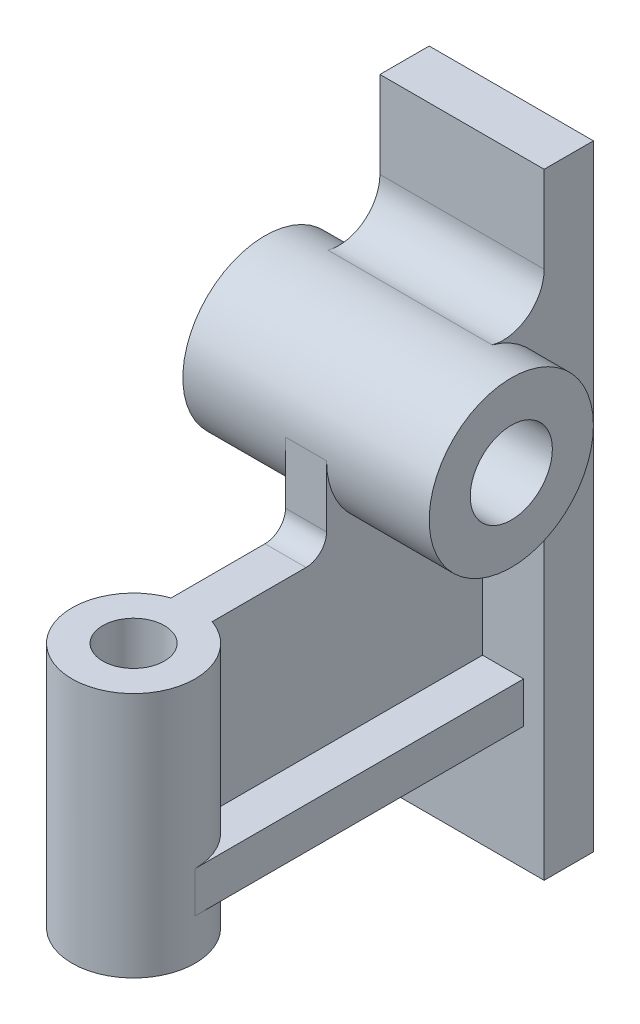
from build123d import *

# Parameters (mm, degrees)
SKETCH1_W                = 150
SKETCH1_H                = 12
BOSS_EXTRUDE1_DEPTH      = 20
SKETCH2_R                = 20
SKETCH2_R_2              = 10
BOSS_EXTRUDE2_DEPTH      = 30
FILLET1_R                = 10
SKETCH3_W                = 10
SKETCH3_H                = 80
BOSS_EXTRUDE3_DEPTH      = 15
BOSS_EXTRUDE4_DEPTH      = 40
BOSS_EXTRUDE4_DEPTH_BACK = 20
SKETCH4_R                = 15
SKETCH4_R_2              = 7.5
RIB1_START               = -5
RIB1_DEPTH               = 10


# Read off the part's stored shape, not the designer's step: Rib1
with BuildPart() as part:
    # Sketch1 → Boss-Extrude1 (new, symmetric)
    with BuildSketch(Plane.YZ):
        with Locations((75, 6)):
            Rectangle(SKETCH1_W, SKETCH1_H)
    extrude(amount=BOSS_EXTRUDE1_DEPTH, both=True)

    # Sketch2 → Boss-Extrude2 (add, symmetric)
    with BuildSketch(Plane.YZ):
        with Locations(Location((100, 30, 0), (0, 0, 270))):
            Circle(SKETCH2_R)
        with Locations(Location((100, 30, 0), (0, 0, 270))):
            Circle(SKETCH2_R_2, mode=Mode.SUBTRACT)
    extrude(amount=BOSS_EXTRUDE2_DEPTH, both=True)

    # Fillet1
    fillet1_edges = [part.edges().sort_by_distance(p)[0] for p in [
        (0, 108.717797887, 12),
    ]]
    fillet(fillet1_edges, radius=FILLET1_R)

    # Sketch3 → Boss-Extrude3 (add, symmetric)
    with BuildSketch(Plane.YZ):
        with Locations((35, 52)):
            Rectangle(SKETCH3_W, SKETCH3_H)
    extrude(amount=BOSS_EXTRUDE3_DEPTH, both=True)

    # Sketch4 → Boss-Extrude4 (add, two sides: drawn at the far end of the back side and taken through both)
    with BuildSketch(Plane(origin=(0, 40, 0), x_dir=(-1, 0, 0), z_dir=(0, 1, 0)).offset(-BOSS_EXTRUDE4_DEPTH_BACK)):
        with Locations(Location((0, 92, 0), (0, 0, 90))):
            Circle(SKETCH4_R)
        with Locations(Location((0, 92, 0), (0, 0, 90))):
            Circle(SKETCH4_R_2, mode=Mode.SUBTRACT)
    extrude(amount=BOSS_EXTRUDE4_DEPTH + BOSS_EXTRUDE4_DEPTH_BACK)

    # Rib1 outline → Rib1 (add)
    with BuildSketch(Plane.YZ.offset(RIB1_START)):
        with BuildLine():
            ThreePointArc((85, 50), (81.464466094, 51.464466094), (80, 55))
            Line((80, 55), (80, 79))
            Line((80, 79), (40, 79))
            Line((40, 79), (40, 12))
            Line((40, 12), (91.282202113, 12))
            ThreePointArc((91.282202113, 12), (80.50641131, 34.472135955), (100, 50))
            Line((100, 50), (85, 50))
        make_face()
    extrude(amount=RIB1_DEPTH)


solid = part.part
